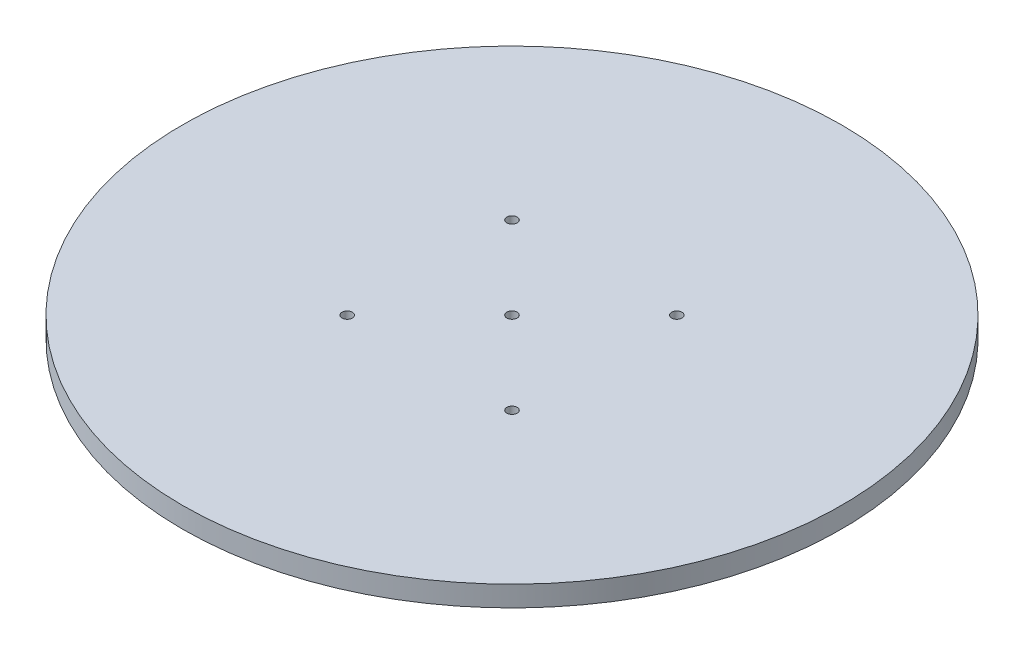
from build123d import *

# Parameters (mm, degrees)
SKETCH1_R                       = 127
BOSS_EXTRUDE1_DEPTH             = 7.9375
F_5_32_0_15625_DIAMETER_HOLE2_D = 3.96875


with BuildPart() as part:
    # Sketch1 → Boss-Extrude1 (new body)
    with BuildSketch(Plane(origin=(0, 0, 0), x_dir=(1, 0, 0), z_dir=(0, 1, 0))):
        Circle(SKETCH1_R)
    extrude(amount=BOSS_EXTRUDE1_DEPTH)

    # 5/32 (0.15625) Diameter Hole2 (through all)
    with Locations(Plane(origin=(0, 7.9375, 0), x_dir=(1, 0, 0), z_dir=(0, 1, 0))):
        with Locations((31.75, 31.75), (-31.75, -31.75), (-31.75, 31.75), (31.75, -31.75), (0, 0)):
            Hole(F_5_32_0_15625_DIAMETER_HOLE2_D / 2)


solid = part.part
